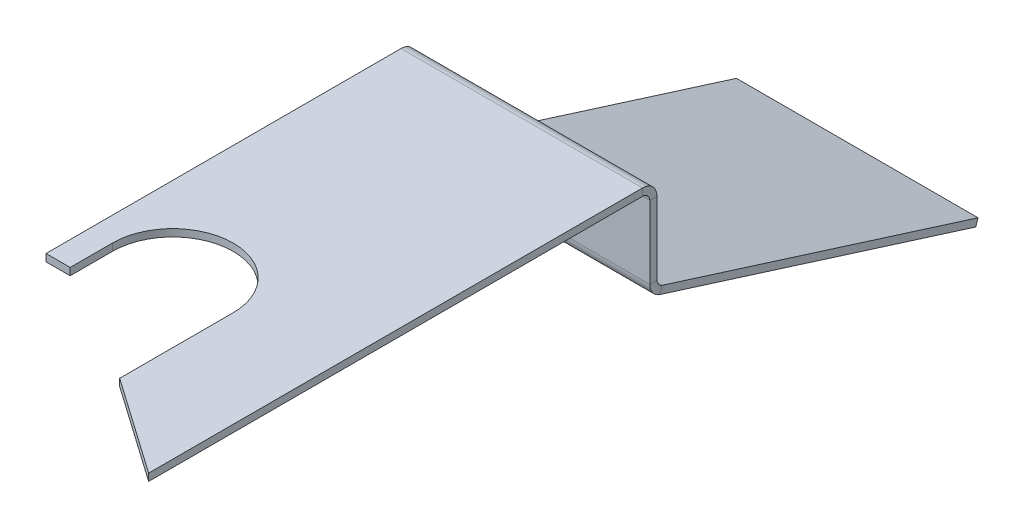
from build123d import *

# Parameters (mm, degrees)
SM_BASE_FLANGE_1_DEPTH = 100
CUT_EXTRUDE_1_DEPTH    = 459.018558576


# Sheet-metal steps are written as plain solids
with BuildPart() as part:
    # Sketch 1 → 基体-法兰1 (new, symmetric)
    with BuildSketch(Plane(origin=(0, 0, 0), x_dir=(0, 0, -1), z_dir=(1, 0, 0))):
        with BuildLine():
            Line((270, -160), (8.396569497, -77.643364471))
            ThreePointArc((8.396569497, -77.643364471), (2.324227007, -73.295019402), (0, -66.197173462))
            Line((0, -66.197173462), (0, -6))
            ThreePointArc((0, -6), (-1.757359313, -1.757359313), (-6, 0))
            Line((-6, 0), (-415, 0))
            Line((-415, 0), (-415, 6))
            Line((-415, 6), (-6, 6))
            ThreePointArc((-6, 6), (2.485281374, 2.485281374), (6, -6))
            Line((6, -6), (6, -66.197173462))
            ThreePointArc((6, -66.197173462), (7.162113503, -69.746096432), (10.198284749, -71.920268967))
            Line((10.198284749, -71.920268967), (271.801715251, -154.276904496))
            Line((271.801715251, -154.276904496), (270, -160))
        make_face()
    extrude(amount=SM_BASE_FLANGE_1_DEPTH, both=True)

    # 草图4 → 切除-拉伸1 (cut, through all)
    with BuildSketch(Plane(origin=(0, 6, 0), x_dir=(1, 0, 0), z_dir=(0, 1, 0))):
        with BuildLine():
            Line((100, -415), (20, -358.983396943))
            Line((20, -358.983396943), (20, -265))
            ThreePointArc((20, -265), (-30, -215), (-80, -265))
            Line((-80, -265), (-80, -300))
            Line((-80, -300), (-100, -300))
            Line((-100, -300), (-100, -415))
            Line((-100, -415), (100, -415))
        make_face()
    extrude(amount=-CUT_EXTRUDE_1_DEPTH, mode=Mode.SUBTRACT)


solid = part.part
